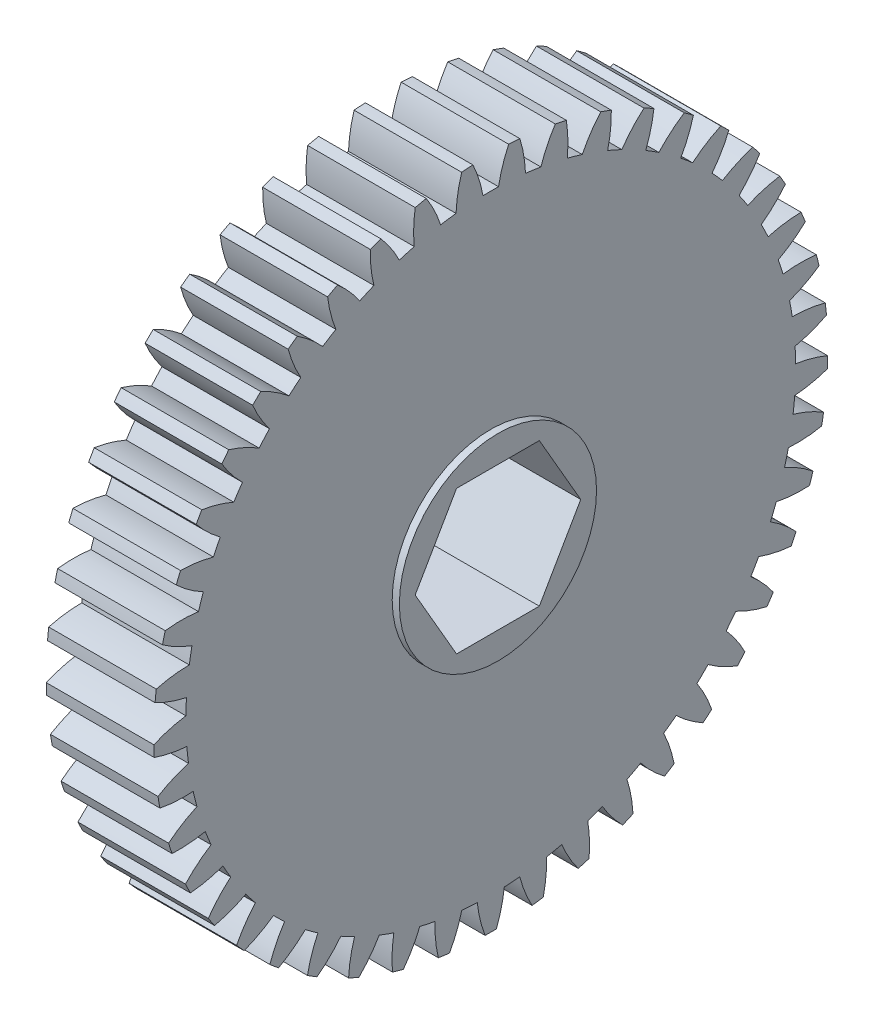
from build123d import *

# Parameters (mm, degrees)
SPUR_START             = -43.041516117
SPUR_GEAR_AI_OUTLINE_R = 6.35
SPUR_GEAR_AI_DEPTH     = 9.525
SKETCH1_R              = 8.73125
BOSS_EXTRUDE1_DEPTH    = 0.635
CUT_EXTRUDE1_DEPTH     = 62.084845455


# Read off the part's stored shape, not the designer's step: spur gear_ai
with BuildPart() as part:
    # spur gear_ai outline → spur gear_ai (new body)
    with BuildSketch(Plane.YZ.offset(SPUR_START)):
        with BuildLine():
            ThreePointArc((34.283258787, 12.487884916), (34.391197734, 12.975592612), (34.49095919, 13.465038487))
            ThreePointArc((34.49095919, 13.465038487), (33.202592906, 14.190213745), (31.831401461, 14.743025519))
            ThreePointArc((31.831401461, 14.743025519), (31.9358185, 15.423015464), (32.02287703, 16.105444988))
            ThreePointArc((32.02287703, 16.105444988), (33.49332642, 16.258890186), (34.93166897, 16.60085151))
            ThreePointArc((34.93166897, 16.60085151), (34.97068167, 17.098835066), (35.001354555, 17.597401798))
            ThreePointArc((35.001354555, 17.597401798), (33.624601674, 18.13621377), (32.18981804, 18.492812652))
            ThreePointArc((32.18981804, 18.492812652), (32.19858259, 19.180717025), (32.18981804, 19.868621397))
            ThreePointArc((32.18981804, 19.868621397), (33.624601674, 20.225220279), (35.001354555, 20.764032251))
            ThreePointArc((35.001354555, 20.764032251), (34.97068167, 21.262598983), (34.93166897, 21.760582539))
            ThreePointArc((34.93166897, 21.760582539), (33.49332642, 22.102543862), (32.02287703, 22.255989061))
            ThreePointArc((32.02287703, 22.255989061), (31.9358185, 22.938418585), (31.831401461, 23.618408529))
            ThreePointArc((31.831401461, 23.618408529), (33.202592906, 24.171220303), (34.49095919, 24.896395562))
            ThreePointArc((34.49095919, 24.896395562), (34.391197734, 25.385841437), (34.283258787, 25.873549132))
            ThreePointArc((34.283258787, 25.873549132), (32.81132227, 26.012003918), (31.333827749, 25.959308798))
            ThreePointArc((31.333827749, 25.959308798), (31.152640633, 26.622980759), (30.954603464, 27.281821045))
            ThreePointArc((30.954603464, 27.281821045), (32.23551404, 28.020085858), (33.410417142, 28.917509692))
            ThreePointArc((33.410417142, 28.917509692), (33.243508858, 29.388308202), (33.068744573, 29.856247361))
            ThreePointArc((33.068744573, 29.856247361), (31.591863659, 29.788500746), (30.136081756, 29.530690956))
            ThreePointArc((30.136081756, 29.530690956), (29.864292656, 30.162687735), (29.576489925, 30.787554785))
            ThreePointArc((29.576489925, 30.787554785), (30.742188164, 31.696903153), (31.780759932, 32.749108228))
            ThreePointArc((31.780759932, 32.749108228), (31.549953499, 33.192095816), (31.311765464, 33.631158536))
            ThreePointArc((31.311765464, 33.631158536), (29.858685961, 33.358529129), (28.452951815, 32.900622645))
            ThreePointArc((28.452951815, 32.900622645), (28.095850796, 33.488643142), (27.723884257, 34.067374632))
            ThreePointArc((27.723884257, 34.067374632), (28.751681169, 35.130107122), (29.633706985, 36.316613463))
            ThreePointArc((29.633706985, 36.316613463), (29.343494788, 36.723167879), (29.046519062, 37.124808304))
            ThreePointArc((29.046519062, 37.124808304), (27.645523508, 36.652602527), (26.317198136, 36.003511977))
            ThreePointArc((26.317198136, 36.003511977), (25.881735764, 36.536111043), (25.432845321, 37.057442621))
            ThreePointArc((25.432845321, 37.057442621), (26.302736008, 38.252874355), (27.011048242, 39.550587966))
            ThreePointArc((27.011048242, 39.550587966), (26.667078932, 39.912796091), (26.31709581, 40.269196746))
            ThreePointArc((26.31709581, 40.269196746), (24.995452991, 39.606605548), (23.770390734, 38.778964741))
            ThreePointArc((23.770390734, 38.778964741), (23.265042788, 39.245775941), (22.747965584, 39.69956048))
            ThreePointArc((22.747965584, 39.69956048), (23.443018613, 41.004423739), (23.963830774, 42.388086101))
            ThreePointArc((23.963830774, 42.388086101), (23.572799322, 42.698897966), (23.176620827, 43.003121918))
            ThreePointArc((23.176620827, 43.003121918), (21.960055017, 42.163041882), (20.862100319, 41.172959906))
            ThreePointArc((20.862100319, 41.172959906), (20.296702823, 41.564897291), (19.721503177, 41.942302392))
            ThreePointArc((19.721503177, 41.942302392), (20.228190132, 43.331199497), (20.551365203, 44.773879195))
            ThreePointArc((20.551365203, 44.773879195), (20.12088259, 45.0272452), (19.686219887, 45.273371076))
            ThreePointArc((19.686219887, 45.273371076), (18.598410155, 44.272153405), (17.648933456, 43.138901079))
            ThreePointArc((17.648933456, 43.138901079), (17.034491228, 43.448336033), (16.412364748, 43.742015936))
            ThreePointArc((16.412364748, 43.742015936), (16.720823542, 45.187913584), (16.840071289, 46.661530499))
            ThreePointArc((16.840071289, 46.661530499), (16.378516371, 46.852519164), (15.913829674, 47.035756403))
            ThreePointArc((15.913829674, 47.035756403), (14.975948999, 45.89288866), (14.193430783, 44.638523451))
            ThreePointArc((14.193430783, 44.638523451), (13.541903242, 44.859433176), (12.884958911, 45.063671734))
            ThreePointArc((12.884958911, 45.063671734), (12.989185747, 46.538427173), (12.902185147, 48.014299028))
            ThreePointArc((12.902185147, 48.014299028), (12.418541565, 48.139192975), (11.932875472, 48.255975074))
            ThreePointArc((11.932875472, 48.255975074), (11.163178635, 46.993701879), (10.562849728, 45.642638579))
            ThreePointArc((10.562849728, 45.642638579), (9.886918117, 45.770723317), (9.20794261, 45.88154526))
            ThreePointArc((9.20794261, 45.88154526), (9.105908829, 47.356454052), (8.814353251, 48.805854681))
            ThreePointArc((8.814353251, 48.805854681), (8.318034577, 48.862222992), (7.820842026, 48.910276919))
            ThreePointArc((7.820842026, 48.910276919), (7.234310301, 47.553166985), (6.827855423, 46.131702504))
            ThreePointArc((6.827855423, 46.131702504), (6.140675981, 46.164469232), (5.452884783, 46.179717537))
            ThreePointArc((5.452884783, 46.179717537), (5.146576358, 47.62607226), (4.656140599, 49.020790728))
            ThreePointArc((4.656140599, 49.020790728), (4.156807111, 49.007536257), (3.65776539, 48.985926697))
            ThreePointArc((3.65776539, 48.985926697), (3.265814949, 47.560394625), (3.061145282, 46.096196153))
            ThreePointArc((3.061145282, 46.096196153), (2.376093176, 46.033007104), (1.692873361, 45.952384979))
            ThreePointArc((1.692873361, 45.952384979), (1.188252237, 47.342033985), (0.50848207, 48.654923682))
            ThreePointArc((0.50848207, 48.654923682), (0.015852728, 48.572304413), (-0.475324884, 48.481451972))
            ThreePointArc((-0.475324884, 48.481451972), (-0.665065171, 47.015244122), (-0.663965966, 45.536810617))
            ThreePointArc((-0.663965966, 45.536810617), (-1.333556975, 45.378895693), (-1.998907311, 45.203972357))
            ThreePointArc((-1.998907311, 45.203972357), (-2.692019258, 46.509867707), (-3.547892879, 47.71537473))
            ThreePointArc((-3.547892879, 47.71537473), (-4.024229607, 47.564998753), (-4.497982896, 47.406671771))
            ThreePointArc((-4.497982896, 47.406671771), (-4.48181995, 45.92832621), (-4.274973267, 44.464433698))
            ThreePointArc((-4.274973267, 44.464433698), (-4.916070353, 44.214866534), (-5.550600922, 43.949046671))
            ThreePointArc((-5.550600922, 43.949046671), (-6.418713057, 45.145770598), (-7.434031525, 46.220431124))
            ThreePointArc((-7.434031525, 46.220431124), (-7.884804285, 46.005225336), (-8.331912183, 45.782505467))
            ThreePointArc((-8.331912183, 45.782505467), (-8.110160598, 44.320796511), (-7.701592472, 42.899937994))
            ThreePointArc((-7.701592472, 42.899937994), (-8.30171741, 42.563576132), (-8.893077796, 42.212033622))
            ThreePointArc((-8.893077796, 42.212033622), (-9.919293303, 43.276293256), (-11.0742946, 44.19919024))
            ThreePointArc((-11.0742946, 44.19919024), (-11.490729614, 43.923343377), (-11.902489673, 43.64056561))
            ThreePointArc((-11.902489673, 43.64056561), (-11.479465591, 42.22394376), (-10.877128336, 40.873774634))
            ThreePointArc((-10.877128336, 40.873774634), (-11.424600376, 40.457164974), (-11.961280422, 40.026742193))
            ThreePointArc((-11.961280422, 40.026742193), (-13.125625185, 40.937822931), (-14.397828523, 41.690993233))
            ThreePointArc((-14.397828523, 41.690993233), (-14.771820356, 41.359874341), (-15.140218136, 41.022542623))
            ThreePointArc((-15.140218136, 41.022542623), (-14.52415524, 39.678580813), (-13.739772666, 38.425380584))
            ThreePointArc((-13.739772666, 38.425380584), (-14.223935887, 37.936631958), (-14.695489727, 37.435706596))
            ThreePointArc((-14.695489727, 37.435706596), (-15.975301098, 38.175875288), (-17.339944487, 38.744659305))
            ThreePointArc((-17.339944487, 38.744659305), (-17.664213814, 38.364713235), (-17.982078871, 37.979393345))
            ThreePointArc((-17.982078871, 37.979393345), (-17.184968124, 36.734250263), (-16.233807345, 35.602411047))
            ThreePointArc((-16.233807345, 35.602411047), (-16.645238061, 35.051036393), (-17.042487436, 34.489358392))
            ThreePointArc((-17.042487436, 34.489358392), (-18.412855342, 35.044208496), (-19.843377551, 35.417535494))
            ThreePointArc((-19.843377551, 35.417535494), (-20.111612839, 34.996157465), (-20.372758291, 34.570349216))
            ThreePointArc((-20.372758291, 34.570349216), (-19.410114548, 33.448260155), (-18.310688827, 32.459811916))
            ThreePointArc((-18.310688827, 32.459811916), (-18.641379006, 31.856543114), (-18.956591908, 31.245044897))
            ThreePointArc((-18.956591908, 31.245044897), (-20.390843698, 31.603776887), (-21.859401239, 31.77438048))
            ThreePointArc((-21.859401239, 31.77438048), (-22.066381593, 31.319772137), (-22.265724541, 30.861763402))
            ThreePointArc((-22.265724541, 30.861763402), (-21.156284566, 29.88456855), (-19.929992974, 29.058750308))
            ThreePointArc((-19.929992974, 29.058750308), (-20.173506109, 28.415329298), (-20.400547278, 27.765912983))
            ThreePointArc((-20.400547278, 27.765912983), (-21.870766871, 27.921544549), (-23.348775942, 27.886104132))
            ThreePointArc((-23.348775942, 27.886104132), (-23.490472725, 27.407113909), (-23.624133185, 26.925819307))
            ThreePointArc((-23.624133185, 26.925819307), (-22.389490966, 26.112538649), (-21.060201873, 25.465424018))
            ThreePointArc((-21.060201873, 25.465424018), (-21.211798259, 24.794374259), (-21.346248596, 24.119679995))
            ThreePointArc((-21.346248596, 24.119679995), (-22.823819841, 24.069181945), (-24.282512677, 23.828387327))
            ThreePointArc((-24.282512677, 23.828387327), (-24.356167921, 23.334338223), (-24.421544345, 22.839125606))
            ThreePointArc((-24.421544345, 22.839125606), (-23.085730788, 22.205588726), (-21.679317295, 21.749773054))
            ThreePointArc((-21.679317295, 21.749773054), (-21.736046279, 21.064155767), (-21.775288862, 20.377315711))
            ThreePointArc((-21.775288862, 20.377315711), (-23.231452515, 20.121670932), (-24.642437319, 19.680208905))
            ThreePointArc((-24.642437319, 19.680208905), (-24.64661741, 19.180717024), (-24.642437319, 18.681225143))
            ThreePointArc((-24.642437319, 18.681225143), (-23.231452515, 18.239763116), (-21.775288862, 17.984118338))
            ThreePointArc((-21.775288862, 17.984118338), (-21.736046279, 17.297278282), (-21.679317295, 16.611660994))
            ThreePointArc((-21.679317295, 16.611660994), (-23.085730787, 16.155845322), (-24.421544345, 15.522308443))
            ThreePointArc((-24.421544345, 15.522308443), (-24.356167921, 15.027095826), (-24.282512677, 14.533046722))
            ThreePointArc((-24.282512677, 14.533046722), (-22.823819841, 14.292252103), (-21.346248596, 14.241754054))
            ThreePointArc((-21.346248596, 14.241754054), (-21.211798259, 13.56705979), (-21.060201873, 12.896010031))
            ThreePointArc((-21.060201873, 12.896010031), (-22.389490965, 12.248895399), (-23.624133185, 11.435614742))
            ThreePointArc((-23.624133185, 11.435614742), (-23.490472725, 10.95432014), (-23.348775942, 10.475329916))
            ThreePointArc((-23.348775942, 10.475329916), (-21.870766871, 10.4398895), (-20.400547278, 10.595521066))
            ThreePointArc((-20.400547278, 10.595521066), (-20.173506109, 9.946104751), (-19.929992974, 9.302683741))
            ThreePointArc((-19.929992974, 9.302683741), (-21.156284566, 8.476865499), (-22.265724541, 7.499670647))
            ThreePointArc((-22.265724541, 7.499670647), (-22.066381593, 7.041661912), (-21.859401239, 6.587053569))
            ThreePointArc((-21.859401239, 6.587053569), (-20.390843698, 6.757657161), (-18.956591908, 7.116389152))
            ThreePointArc((-18.956591908, 7.116389152), (-18.641379006, 6.504890935), (-18.310688827, 5.901622132))
            ThreePointArc((-18.310688827, 5.901622132), (-19.410114548, 4.913173893), (-20.372758291, 3.791084833))
            ThreePointArc((-20.372758291, 3.791084833), (-20.111612839, 3.365276583), (-19.843377551, 2.943898555))
            ThreePointArc((-19.843377551, 2.943898555), (-18.412855342, 3.317225552), (-17.042487436, 3.872075657))
            ThreePointArc((-17.042487436, 3.872075657), (-16.645238061, 3.310397655), (-16.233807345, 2.759023001))
            ThreePointArc((-16.233807345, 2.759023001), (-17.184968124, 1.627183786), (-17.982078871, 0.382040704))
            ThreePointArc((-17.982078871, 0.382040704), (-17.664213814, -0.003279187), (-17.339944487, -0.383225256))
            ThreePointArc((-17.339944487, -0.383225256), (-15.975301097, 0.18555876), (-14.695489727, 0.925727453))
            ThreePointArc((-14.695489727, 0.925727453), (-14.223935887, 0.42480209), (-13.739772666, -0.063946535))
            ThreePointArc((-13.739772666, -0.063946535), (-14.52415524, -1.317146765), (-15.140218136, -2.661108574))
            ThreePointArc((-15.140218136, -2.661108574), (-14.771820356, -2.998440292), (-14.397828523, -3.329559185))
            ThreePointArc((-14.397828523, -3.329559185), (-13.125625185, -2.576388883), (-11.961280422, -1.665308144))
            ThreePointArc((-11.961280422, -1.665308144), (-11.424600375, -2.095730925), (-10.877128336, -2.512340586))
            ThreePointArc((-10.877128336, -2.512340586), (-11.479465591, -3.862509712), (-11.902489673, -5.279131561))
            ThreePointArc((-11.902489673, -5.279131561), (-11.490729614, -5.561909329), (-11.0742946, -5.837756192))
            ThreePointArc((-11.0742946, -5.837756192), (-9.919293303, -4.914859208), (-8.893077796, -3.850599573))
            ThreePointArc((-8.893077796, -3.850599573), (-8.301717409, -4.202142083), (-7.701592472, -4.538503946))
            ThreePointArc((-7.701592472, -4.538503946), (-8.110160598, -5.959362462), (-8.331912183, -7.421071418))
            ThreePointArc((-8.331912183, -7.421071418), (-7.884804285, -7.643791288), (-7.434031525, -7.858997076))
            ThreePointArc((-7.434031525, -7.858997076), (-6.418713057, -6.78433655), (-5.550600922, -5.587612622))
            ThreePointArc((-5.550600922, -5.587612622), (-4.916070353, -5.853432486), (-4.274973267, -6.102999649))
            ThreePointArc((-4.274973267, -6.102999649), (-4.48181995, -7.566892161), (-4.497982896, -9.045237722))
            ThreePointArc((-4.497982896, -9.045237722), (-4.024229607, -9.203564705), (-3.547892879, -9.353940682))
            ThreePointArc((-3.547892879, -9.353940682), (-2.692019258, -8.148433659), (-1.998907311, -6.842538308))
            ThreePointArc((-1.998907311, -6.842538308), (-1.333556975, -7.017461644), (-0.663965966, -7.175376568))
            ThreePointArc((-0.663965966, -7.175376568), (-0.665065171, -8.653810073), (-0.475324884, -10.120017924))
            ThreePointArc((-0.475324884, -10.120017924), (0.015852728, -10.210870364), (0.50848207, -10.293489634))
            ThreePointArc((0.50848207, -10.293489634), (1.188252237, -8.980599936), (1.692873361, -7.590950931))
            ThreePointArc((1.692873361, -7.590950931), (2.376093177, -7.671573055), (3.061145282, -7.734762104))
            ThreePointArc((3.061145282, -7.734762104), (3.265814949, -9.198960576), (3.65776539, -10.624492649))
            ThreePointArc((3.65776539, -10.624492649), (4.156807111, -10.646102208), (4.656140599, -10.659356679))
            ThreePointArc((4.656140599, -10.659356679), (5.146576358, -9.264638212), (5.452884783, -7.818283488))
            ThreePointArc((5.452884783, -7.818283488), (6.140675981, -7.803035183), (6.827855423, -7.770268455))
            ThreePointArc((6.827855423, -7.770268455), (7.234310301, -9.191732936), (7.820842026, -10.54884287))
            ThreePointArc((7.820842026, -10.54884287), (8.318034577, -10.500788943), (8.814353251, -10.444420633))
            ThreePointArc((8.814353251, -10.444420633), (9.105908829, -8.995020004), (9.20794261, -7.520111212))
            ThreePointArc((9.20794261, -7.520111212), (9.886918117, -7.409289269), (10.562849728, -7.28120453))
            ThreePointArc((10.562849728, -7.28120453), (11.163178635, -8.632267831), (11.932875472, -9.894541025))
            ThreePointArc((11.932875472, -9.894541025), (12.418541565, -9.777758926), (12.902185147, -9.65286498))
            ThreePointArc((12.902185147, -9.65286498), (12.989185747, -8.176993125), (12.884958911, -6.702237686))
            ThreePointArc((12.884958911, -6.702237686), (13.541903242, -6.497999127), (14.193430783, -6.277089402))
            ThreePointArc((14.193430783, -6.277089402), (14.975948999, -7.531454612), (15.913829674, -8.674322355))
            ThreePointArc((15.913829674, -8.674322355), (16.378516371, -8.491085115), (16.840071289, -8.300096451))
            ThreePointArc((16.840071289, -8.300096451), (16.720823542, -6.826479536), (16.412364748, -5.380581887))
            ThreePointArc((16.412364748, -5.380581887), (17.034491228, -5.086901985), (17.648933456, -4.77746703))
            ThreePointArc((17.648933456, -4.77746703), (18.598410155, -5.910719357), (19.686219887, -6.911937028))
            ThreePointArc((19.686219887, -6.911937028), (20.12088259, -6.665811152), (20.551365203, -6.412445146))
            ThreePointArc((20.551365203, -6.412445146), (20.228190132, -4.969765448), (19.721503177, -3.580868344))
            ThreePointArc((19.721503177, -3.580868344), (20.296702823, -3.203463242), (20.862100319, -2.811525857))
            ThreePointArc((20.862100319, -2.811525857), (21.960055016, -3.801607833), (23.176620827, -4.641687869))
            ThreePointArc((23.176620827, -4.641687869), (23.572799322, -4.337463917), (23.963830774, -4.026652052))
            ThreePointArc((23.963830774, -4.026652052), (23.443018613, -2.642989691), (22.747965584, -1.338126432))
            ThreePointArc((22.747965584, -1.338126432), (23.265042788, -0.884341893), (23.770390734, -0.417530692))
            ThreePointArc((23.770390734, -0.417530692), (24.995452991, -1.245171499), (26.31709581, -1.907762697))
            ThreePointArc((26.31709581, -1.907762697), (26.667078932, -1.551362042), (27.011048242, -1.189153917))
            ThreePointArc((27.011048242, -1.189153917), (26.302736008, 0.108559694), (25.432845321, 1.303991428))
            ThreePointArc((25.432845321, 1.303991428), (25.881735764, 1.825323005), (26.317198136, 2.357922072))
            ThreePointArc((26.317198136, 2.357922072), (27.645523508, 1.708831521), (29.046519062, 1.236625745))
            ThreePointArc((29.046519062, 1.236625745), (29.343494788, 1.63826617), (29.633706985, 2.044820586))
            ThreePointArc((29.633706985, 2.044820586), (28.751681169, 3.231326927), (27.723884257, 4.294059417))
            ThreePointArc((27.723884257, 4.294059417), (28.095850796, 4.872790906), (28.452951815, 5.460811404))
            ThreePointArc((28.452951815, 5.460811404), (29.85868596, 5.002904919), (31.311765464, 4.730275513))
            ThreePointArc((31.311765464, 4.730275513), (31.549953499, 5.169338233), (31.780759932, 5.612325821))
            ThreePointArc((31.780759932, 5.612325821), (30.742188164, 6.664530896), (29.576489925, 7.573879263))
            ThreePointArc((29.576489925, 7.573879263), (29.864292656, 8.198746314), (30.136081756, 8.830743093))
            ThreePointArc((30.136081756, 8.830743093), (31.591863659, 8.572933303), (33.068744573, 8.505186687))
            ThreePointArc((33.068744573, 8.505186687), (33.243508858, 8.973125847), (33.410417142, 9.443924357))
            ThreePointArc((33.410417142, 9.443924357), (32.23551404, 10.341348191), (30.954603464, 11.079613004))
            ThreePointArc((30.954603464, 11.079613004), (31.152640633, 11.73845329), (31.333827749, 12.402125251))
            ThreePointArc((31.333827749, 12.402125251), (32.81132227, 12.34943013), (34.283258787, 12.487884916))
        make_face()
        with Locations((5.19838259, 19.180717024)):
            Circle(SPUR_GEAR_AI_OUTLINE_R, mode=Mode.SUBTRACT)
    extrude(amount=SPUR_GEAR_AI_DEPTH)

    # Sketch1 → Boss-Extrude1 (add)
    with BuildSketch(Plane(origin=(-33.516516117, 0, 0), x_dir=(0, 0, -1), z_dir=(1, 0, 0))):
        with Locations(Location((-19.180717024, 5.19838259, 0), (0, 0, 180))):
            Circle(SKETCH1_R)
    extrude(amount=BOSS_EXTRUDE1_DEPTH)

    # Sketch2 → Cut-Extrude1 (cut, through all)
    with BuildSketch(Plane(origin=(-32.881516117, 0, 0), x_dir=(0, 0, -1), z_dir=(1, 0, 0))):
        Polygon((-15.514542815, 11.54838259), (-22.846891234, 11.54838259), (-26.513065443, 5.19838259), (-22.846891234, -1.15161741), (-15.514542815, -1.15161741), (-11.848368606, 5.19838259), align=None)
    extrude(amount=-CUT_EXTRUDE1_DEPTH, mode=Mode.SUBTRACT)


solid = part.part
